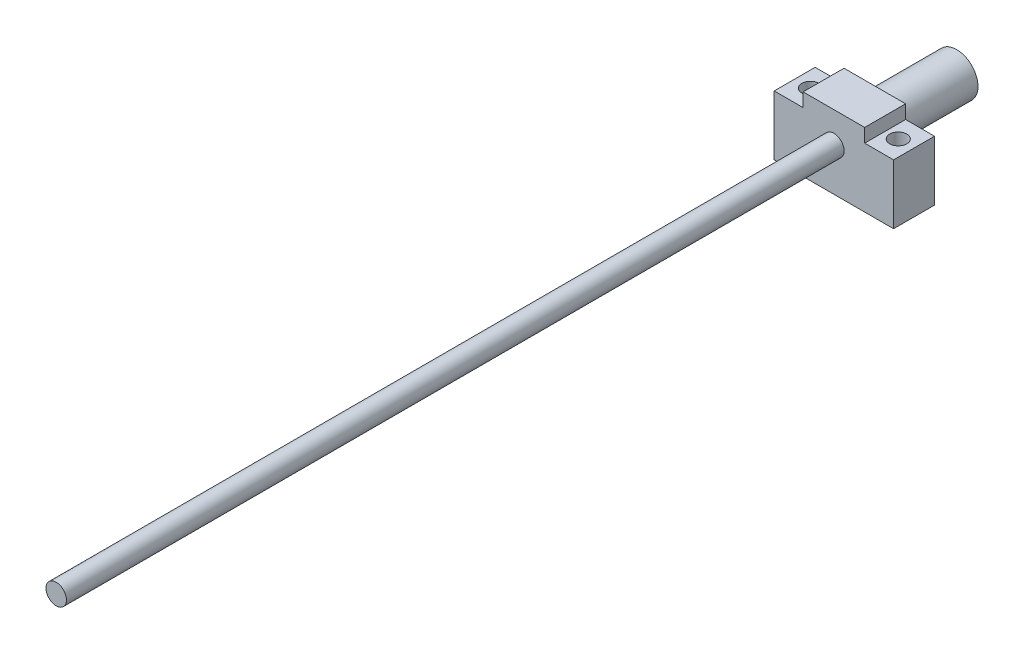
from build123d import *

# Parameters (mm, degrees)
SKETCH1_R                    = 12.5
SKETCH1_R_2                  = 6
BOSS_EXTRUDE1_DEPTH          = 24
SKETCH1_2_R                  = 6
BOSS_EXTRUDE2_DEPTH          = 480
SKETCH1_4_R                  = 12.5
BOSS_EXTRUDE3_DEPTH          = 48
M8_START                     = -17.5
M8_CLEARANCE_HOLE1_OUTLINE_R = 5
M8_CLEARANCE_HOLE1_DEPTH     = 35
SKETCH4_R                    = 4
CUT_EXTRUDE1_DEPTH           = 30


# Read off the part's stored shape, not the designer's step: M8 Clearance Hole1
with BuildPart() as part:
    # Sketch1 → Boss-Extrude1 (new body)
    # profile 1 of 2: a face of its own
    with BuildSketch(Plane.XY):
        Polygon((18.05, 17.5), (18.05, 25.5), (-18.05, 25.5), (-18.05, 17.5), (-35, 17.5), (-35, -17.5), (35, -17.5), (35, 17.5), align=None)
        with Locations((0, 7.5)):
            Circle(SKETCH1_R, mode=Mode.SUBTRACT)
    # profile 2 of 2: a face of its own
    with BuildSketch(Plane.XY):
        with Locations((0, 7.5)):
            Circle(SKETCH1_R)
        with Locations((0, 7.5)):
            Circle(SKETCH1_R_2, mode=Mode.SUBTRACT)
    extrude(amount=BOSS_EXTRUDE1_DEPTH)

    # Sketch1<2> → Boss-Extrude2 (add)
    with BuildSketch(Plane.XY):
        with Locations((0, 7.5)):
            Circle(SKETCH1_2_R)
    extrude(amount=BOSS_EXTRUDE2_DEPTH)

    # Sketch1<4> → Boss-Extrude3 (add)
    with BuildSketch(Plane.XY):
        with Locations((0, 7.5)):
            Circle(SKETCH1_4_R)
    extrude(amount=-BOSS_EXTRUDE3_DEPTH)

    # M8 Clearance Hole1 outline → M8 Clearance Hole1 (cut)
    with BuildSketch(Plane(origin=(0, 0, 0), x_dir=(1, 0, 0), z_dir=(0, 1, 0)).offset(M8_START)):
        with Locations((25.75, -12)):
            Circle(M8_CLEARANCE_HOLE1_OUTLINE_R)
        with Locations((-25.75, -12)):
            Circle(M8_CLEARANCE_HOLE1_OUTLINE_R)
    extrude(amount=M8_CLEARANCE_HOLE1_DEPTH, mode=Mode.SUBTRACT)

    # Sketch4 → Cut-Extrude1 (cut)
    with BuildSketch(Plane(origin=(0, 0, -48), x_dir=(-1, 0, 0), z_dir=(0, 0, -1))):
        with Locations((0, 7.5)):
            Circle(SKETCH4_R)
    extrude(amount=-CUT_EXTRUDE1_DEPTH, mode=Mode.SUBTRACT)


solid = part.part
